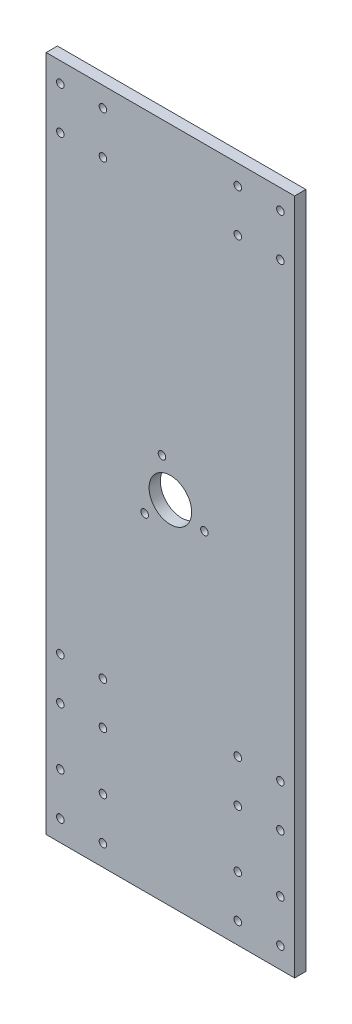
from build123d import *

# Parameters (mm, degrees)
SKETCH1_W           = 140
SKETCH1_H           = 381.65
SKETCH1_R           = 2.125
BOSS_EXTRUDE1_DEPTH = 6.35
SKETCH2_R           = 12
SKETCH2_R_2         = 2.125
CUT_EXTRUDE1_DEPTH  = 204.358066289


with BuildPart() as part:
    # Sketch1 → Boss-Extrude1 (new body)
    with BuildSketch(Plane.XY):
        Rectangle(SKETCH1_W, SKETCH1_H)
        with Locations((-62, 179.65)):
            Circle(SKETCH1_R, mode=Mode.SUBTRACT)
        with Locations((-38, 179.65)):
            Circle(SKETCH1_R, mode=Mode.SUBTRACT)
        with Locations((-38, 155.65)):
            Circle(SKETCH1_R, mode=Mode.SUBTRACT)
        with Locations((-62, 155.65)):
            Circle(SKETCH1_R, mode=Mode.SUBTRACT)
        with Locations((38, 155.65)):
            Circle(SKETCH1_R, mode=Mode.SUBTRACT)
        with Locations((62, 155.65)):
            Circle(SKETCH1_R, mode=Mode.SUBTRACT)
        with Locations((38, 179.65)):
            Circle(SKETCH1_R, mode=Mode.SUBTRACT)
        with Locations((62, 179.65)):
            Circle(SKETCH1_R, mode=Mode.SUBTRACT)
        with Locations((62, -179)):
            Circle(SKETCH1_R, mode=Mode.SUBTRACT)
        with Locations((38, -179)):
            Circle(SKETCH1_R, mode=Mode.SUBTRACT)
        with Locations((62, -155)):
            Circle(SKETCH1_R, mode=Mode.SUBTRACT)
        with Locations((38, -155)):
            Circle(SKETCH1_R, mode=Mode.SUBTRACT)
        with Locations((-62, -155)):
            Circle(SKETCH1_R, mode=Mode.SUBTRACT)
        with Locations((-38, -155)):
            Circle(SKETCH1_R, mode=Mode.SUBTRACT)
        with Locations((-38, -179)):
            Circle(SKETCH1_R, mode=Mode.SUBTRACT)
        with Locations((-62, -179)):
            Circle(SKETCH1_R, mode=Mode.SUBTRACT)
        with Locations((-62, -98.75)):
            Circle(SKETCH1_R, mode=Mode.SUBTRACT)
        with Locations((-38, -98.75)):
            Circle(SKETCH1_R, mode=Mode.SUBTRACT)
        with Locations((-38, -122.75)):
            Circle(SKETCH1_R, mode=Mode.SUBTRACT)
        with Locations((-62, -122.75)):
            Circle(SKETCH1_R, mode=Mode.SUBTRACT)
        with Locations((38, -122.75)):
            Circle(SKETCH1_R, mode=Mode.SUBTRACT)
        with Locations((62, -122.75)):
            Circle(SKETCH1_R, mode=Mode.SUBTRACT)
        with Locations((38, -98.75)):
            Circle(SKETCH1_R, mode=Mode.SUBTRACT)
        with Locations((62, -98.75)):
            Circle(SKETCH1_R, mode=Mode.SUBTRACT)
    extrude(amount=BOSS_EXTRUDE1_DEPTH)

    # Sketch2 → Cut-Extrude1 (cut, through all)
    with BuildSketch(Plane.XY.offset(6.35)):
        with Locations((0, 7.475)):
            Circle(SKETCH2_R)
        with Locations((-4.730640539, 26.907473854)):
            Circle(SKETCH2_R_2)
        with Locations((19.194336286, 1.855617956)):
            Circle(SKETCH2_R_2)
        with Locations((-14.463695746, -6.33809181)):
            Circle(SKETCH2_R_2)
    extrude(amount=-CUT_EXTRUDE1_DEPTH, mode=Mode.SUBTRACT)


solid = part.part
